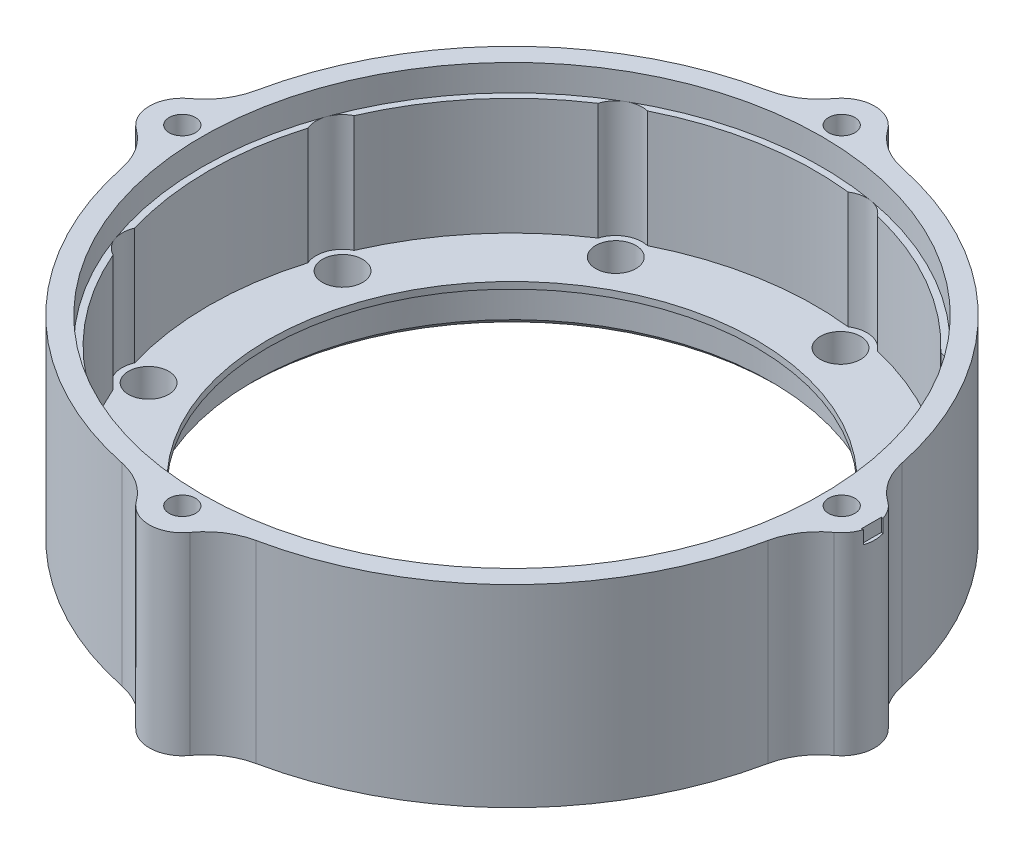
from build123d import *
from build123d.topology import SkipClean

# Parameters (mm, degrees)
SKETCH1_R            = 50
BOSS_EXTRUDE1_DEPTH  = 5
SKETCH2_R            = 3
BOSS_EXTRUDE2_DEPTH  = 30
SKETCH3_R            = 50
BOSS_EXTRUDE3_DEPTH  = 28
SKETCH4_R            = 39.25
CUT_EXTRUDE1_DEPTH   = 6
SKETCH5_R            = 3
CUT_EXTRUDE2_DEPTH   = 44
SKETCH6_R            = 50
SKETCH6_R_2          = 39
BOSS_EXTRUDE4_DEPTH  = 3
CUT_EXTRUDE3_START   = -4
SKETCH7_R            = 47
SKETCH7_R_2          = 46
CUT_EXTRUDE3_DEPTH   = 4
SKETCH8_R            = 39
SKETCH8_R_2          = 37
BOSS_EXTRUDE5_DEPTH  = 1
SKETCH9_R            = 5
SKETCH9_R_2          = 2
BOSS_EXTRUDE6_DEPTH  = 33
SKETCH10_R           = 3.05
CUT_EXTRUDE6_DEPTH   = 2.5
SKETCH11_R           = 47.15
CUT_EXTRUDE7_DEPTH   = 4
SKETCH12_R           = 39.25
SKETCH12_R_2         = 3.05
BOSS_EXTRUDE7_DEPTH  = 6.3
BOSS_EXTRUDE8_START  = -1
SKETCH13_R           = 39.25
SKETCH13_R_2         = 37
BOSS_EXTRUDE8_DEPTH  = 1
SKETCH14_W           = 114
SKETCH14_H           = 3
CUT_EXTRUDE8_DEPTH   = 59.5
SKETCH15_R           = 39.25
SKETCH15_R_2         = 2
BOSS_EXTRUDE9_DEPTH  = 1
SKETCH16_R           = 3.05
BOSS_EXTRUDE10_DEPTH = 0.7
SKETCH17_W           = 114.080184059
SKETCH17_H           = 0.7
CUT_EXTRUDE9_DEPTH   = 69.85
CUT_EXTRUDE10_START  = -8
CUT_EXTRUDE10_DEPTH  = 8
CUT_EXTRUDE12_START  = -21.3
SKETCH20_R           = 57
SKETCH20_R_2         = 50
CUT_EXTRUDE12_DEPTH  = 21.3
BOSS_EXTRUDE11_START = -21.3
BOSS_EXTRUDE11_DEPTH = 21.3
CUT_EXTRUDE13_START  = -21.3
CUT_EXTRUDE13_DEPTH  = 21.3
FILLET1_R            = 10
SKETCH23_R           = 2
BOSS_EXTRUDE12_DEPTH = 8
CUT_EXTRUDE14_START  = -4
SKETCH24_R           = 47
SKETCH24_R_2         = 46
CUT_EXTRUDE14_DEPTH  = 4
SKETCH25_W           = 1
SKETCH25_H           = 3
CUT_EXTRUDE15_DEPTH  = 2
CHAMFER1_SIZE        = 1


# Read off the part's stored shape, not the designer's step: Cut-Extrude13
with BuildPart() as part:
    # Sketch1 → Boss-Extrude1 (new body)
    with BuildSketch(Plane(origin=(0, 0, 0), x_dir=(1, 0, 0), z_dir=(0, 1, 0))):
        with Locations(Location((0, 0, 0), (0, 0, 270))):
            Circle(SKETCH1_R)
    extrude(amount=BOSS_EXTRUDE1_DEPTH)

    # Sketch2 → Boss-Extrude2 (add)
    with BuildSketch(Plane(origin=(0, 5, 0), x_dir=(1, 0, 0), z_dir=(0, 1, 0))):
        with Locations(Location((43, 0, 0), (0, 0, 270))):
            Circle(SKETCH2_R)
        with Locations(Location((32.939911054, -27.639867217, 0), (0, 0, 270))):
            Circle(SKETCH2_R)
        with Locations(Location((7.46687164, -42.34673338, 0), (0, 0, 270))):
            Circle(SKETCH2_R)
        with Locations(Location((-21.5, -37.239092363, 0), (0, 0, 270))):
            Circle(SKETCH2_R)
        with Locations(Location((-40.406782694, -14.706866163, 0), (0, 0, 270))):
            Circle(SKETCH2_R)
        with Locations(Location((-40.406782694, 14.706866163, 0), (0, 0, 270))):
            Circle(SKETCH2_R)
        with Locations(Location((-21.5, 37.239092363, 0), (0, 0, 270))):
            Circle(SKETCH2_R)
        with Locations(Location((7.46687164, 42.34673338, 0), (0, 0, 270))):
            Circle(SKETCH2_R)
        with Locations(Location((32.939911054, 27.639867217, 0), (0, 0, 270))):
            Circle(SKETCH2_R)
    extrude(amount=BOSS_EXTRUDE2_DEPTH)

    # Sketch3 → Boss-Extrude3 (add)
    with BuildSketch(Plane(origin=(0, 5, 0), x_dir=(1, 0, 0), z_dir=(0, 1, 0))):
        with Locations(Location((0, 0, 0), (0, 0, 270))):
            Circle(SKETCH3_R)
        with BuildLine():
            ThreePointArc((45.918604651, 2.735278211), (43.225860556, 15.732926593), (36.933894872, 27.42056545))
            ThreePointArc((36.933894872, 27.42056545), (36.004088827, 30.211017655), (33.417488986, 31.611254798))
            ThreePointArc((33.417488986, 31.611254798), (23, 39.837168574), (10.667405207, 44.746021791))
            ThreePointArc((10.667405207, 44.746021791), (8.16146435, 46.285964392), (5.27995883, 45.695973945))
            ThreePointArc((5.27995883, 45.695973945), (-7.987816173, 45.301156639), (-20.590481909, 41.13431724))
            ThreePointArc((-20.590481909, 41.13431724), (-23.5, 40.703193978), (-25.328122743, 38.399039029))
            ThreePointArc((-25.328122743, 38.399039029), (-35.238044383, 29.568230046), (-42.213853702, 18.275408495))
            ThreePointArc((-42.213853702, 18.275408495), (-44.165553177, 16.074946736), (-44.084894193, 13.134766994))
            ThreePointArc((-44.084894193, 13.134766994), (-46, 0), (-44.084894193, -13.134766994))
            ThreePointArc((-44.084894193, -13.134766994), (-44.165553177, -16.074946736), (-42.213853702, -18.275408495))
            ThreePointArc((-42.213853702, -18.275408495), (-35.238044383, -29.568230046), (-25.328122743, -38.399039029))
            ThreePointArc((-25.328122743, -38.399039029), (-23.5, -40.703193978), (-20.590481909, -41.13431724))
            ThreePointArc((-20.590481909, -41.13431724), (-7.987816173, -45.301156639), (5.27995883, -45.695973945))
            ThreePointArc((5.27995883, -45.695973945), (8.16146435, -46.285964392), (10.667405207, -44.746021791))
            ThreePointArc((10.667405207, -44.746021791), (23, -39.837168574), (33.417488986, -31.611254798))
            ThreePointArc((33.417488986, -31.611254798), (36.004088827, -30.211017655), (36.933894872, -27.42056545))
            ThreePointArc((36.933894872, -27.42056545), (43.225860556, -15.732926593), (45.918604651, -2.735278211))
            ThreePointArc((45.918604651, -2.735278211), (47, 0), (45.918604651, 2.735278211))
        make_face(mode=Mode.SUBTRACT)
    extrude(amount=BOSS_EXTRUDE3_DEPTH)

    # Sketch4 → Cut-Extrude1 (cut)
    with BuildSketch(Plane(origin=(0, 5, 0), x_dir=(1, 0, 0), z_dir=(0, 1, 0))):
        with Locations(Location((0, 0, 0), (0, 0, 270))):
            Circle(SKETCH4_R)
    extrude(amount=-CUT_EXTRUDE1_DEPTH, mode=Mode.SUBTRACT)

    # Sketch5 → Cut-Extrude2 (cut, symmetric)
    with BuildSketch(Plane(origin=(0, 5, 0), x_dir=(1, 0, 0), z_dir=(0, 1, 0))):
        with Locations(Location((43, 0, 0), (0, 0, 270))):
            Circle(SKETCH5_R)
        with Locations(Location((32.939911054, -27.639867217, 0), (0, 0, 270))):
            Circle(SKETCH5_R)
        with Locations(Location((7.46687164, -42.34673338, 0), (0, 0, 270))):
            Circle(SKETCH5_R)
        with Locations(Location((-21.5, -37.239092363, 0), (0, 0, 270))):
            Circle(SKETCH5_R)
        with Locations(Location((-40.406782694, -14.706866163, 0), (0, 0, 270))):
            Circle(SKETCH5_R)
        with Locations(Location((-40.406782694, 14.706866163, 0), (0, 0, 270))):
            Circle(SKETCH5_R)
        with Locations(Location((-21.5, 37.239092363, 0), (0, 0, 270))):
            Circle(SKETCH5_R)
        with Locations(Location((7.46687164, 42.34673338, 0), (0, 0, 270))):
            Circle(SKETCH5_R)
        with Locations(Location((32.939911054, 27.639867217, 0), (0, 0, 270))):
            Circle(SKETCH5_R)
    extrude(amount=CUT_EXTRUDE2_DEPTH, both=True, mode=Mode.SUBTRACT)

    # Sketch6 → Boss-Extrude4 (add)
    with BuildSketch(Plane.XZ):
        with Locations(Location((0, 0, 0), (0, 0, 90))):
            Circle(SKETCH6_R)
        with Locations(Location((0, 0, 0), (0, 0, 270))):
            Circle(SKETCH6_R_2, mode=Mode.SUBTRACT)
    extrude(amount=-BOSS_EXTRUDE4_DEPTH)

    # Sketch7 → Cut-Extrude3 (cut)
    with BuildSketch(Plane(origin=(0, 33, 0), x_dir=(1, 0, 0), z_dir=(0, 1, 0)).offset(CUT_EXTRUDE3_START)):
        with Locations(Location((0, 0, 0), (0, 0, 270))):
            Circle(SKETCH7_R)
        Circle(SKETCH7_R_2, mode=Mode.SUBTRACT)
    extrude(amount=CUT_EXTRUDE3_DEPTH, mode=Mode.SUBTRACT)

    # Sketch8 → Boss-Extrude5 (add)
    with BuildSketch(Plane.XZ):
        with Locations(Location((0, 0, 0), (0, 0, 270))):
            Circle(SKETCH8_R)
        with Locations(Location((0, 0, 0), (0, 0, 270))):
            Circle(SKETCH8_R_2, mode=Mode.SUBTRACT)
    extrude(amount=-BOSS_EXTRUDE5_DEPTH)

    # Sketch9 → Boss-Extrude6 (add)
    # profile 1 of 4: a face of its own
    with BuildSketch(Plane(origin=(0, 33, 0), x_dir=(1, 0, 0), z_dir=(0, 1, 0))):
        with Locations((52, 0)):
            Circle(SKETCH9_R)
        with Locations(Location((52, 0, 0), (0, 0, 270))):
            Circle(SKETCH9_R_2, mode=Mode.SUBTRACT)
    # profile 2 of 4: a face of its own
    with BuildSketch(Plane(origin=(0, 33, 0), x_dir=(1, 0, 0), z_dir=(0, 1, 0))):
        with Locations((-52, 0)):
            Circle(SKETCH9_R)
        with Locations(Location((-52, 0, 0), (0, 0, 270))):
            Circle(SKETCH9_R_2, mode=Mode.SUBTRACT)
    # profile 3 of 4: a face of its own
    with BuildSketch(Plane(origin=(0, 33, 0), x_dir=(1, 0, 0), z_dir=(0, 1, 0))):
        with Locations((0, 52)):
            Circle(SKETCH9_R)
        with Locations(Location((0, 52, 0), (0, 0, 270))):
            Circle(SKETCH9_R_2, mode=Mode.SUBTRACT)
    # profile 4 of 4: a face of its own
    with BuildSketch(Plane(origin=(0, 33, 0), x_dir=(1, 0, 0), z_dir=(0, 1, 0))):
        with Locations((0, -52)):
            Circle(SKETCH9_R)
        with Locations(Location((0, -52, 0), (0, 0, 270))):
            Circle(SKETCH9_R_2, mode=Mode.SUBTRACT)
    extrude(amount=-BOSS_EXTRUDE6_DEPTH)

    # Sketch10 → Cut-Extrude6 (cut)
    with BuildSketch(Plane(origin=(0, 5, 0), x_dir=(1, 0, 0), z_dir=(0, 1, 0))):
        with Locations(Location((32.939911054, -27.639867217, 0), (0, 0, 270))):
            Circle(SKETCH10_R)
        with Locations(Location((43, 0, 0), (0, 0, 270))):
            Circle(SKETCH10_R)
        with Locations(Location((7.46687164, -42.34673338, 0), (0, 0, 270))):
            Circle(SKETCH10_R)
        with Locations(Location((-21.5, -37.239092363, 0), (0, 0, 270))):
            Circle(SKETCH10_R)
        with Locations(Location((-40.406782694, -14.706866163, 0), (0, 0, 270))):
            Circle(SKETCH10_R)
        with Locations(Location((-40.406782694, 14.706866163, 0), (0, 0, 270))):
            Circle(SKETCH10_R)
        with Locations(Location((-21.5, 37.239092363, 0), (0, 0, 270))):
            Circle(SKETCH10_R)
        with Locations(Location((7.46687164, 42.34673338, 0), (0, 0, 270))):
            Circle(SKETCH10_R)
        with Locations(Location((32.939911054, 27.639867217, 0), (0, 0, 270))):
            Circle(SKETCH10_R)
    extrude(amount=-CUT_EXTRUDE6_DEPTH, mode=Mode.SUBTRACT)

    # Sketch11 → Cut-Extrude7 (cut)
    with BuildSketch(Plane(origin=(0, 33, 0), x_dir=(1, 0, 0), z_dir=(0, 1, 0))):
        with Locations(Location((0, 0, 0), (0, 0, 270))):
            Circle(SKETCH11_R)
    extrude(amount=-CUT_EXTRUDE7_DEPTH, mode=Mode.SUBTRACT)

    # Sketch12 → Boss-Extrude7 (add)
    with BuildSketch(Plane(origin=(0, 5, 0), x_dir=(1, 0, 0), z_dir=(0, 1, 0))):
        with BuildLine():
            ThreePointArc((36.933894872, -27.42056545), (43.225860556, -15.732926593), (45.918604651, -2.735278211))
            ThreePointArc((45.918604651, -2.735278211), (47, 0), (45.918604651, 2.735278211))
            ThreePointArc((45.918604651, 2.735278211), (43.225860556, 15.732926593), (36.933894872, 27.42056545))
            ThreePointArc((36.933894872, 27.42056545), (36.004088827, 30.211017655), (33.417488986, 31.611254798))
            ThreePointArc((33.417488986, 31.611254798), (23, 39.837168574), (10.667405207, 44.746021791))
            ThreePointArc((10.667405207, 44.746021791), (8.16146435, 46.285964392), (5.27995883, 45.695973945))
            ThreePointArc((5.27995883, 45.695973945), (-7.987816173, 45.301156639), (-20.590481909, 41.13431724))
            ThreePointArc((-20.590481909, 41.13431724), (-23.5, 40.703193978), (-25.328122743, 38.399039029))
            ThreePointArc((-25.328122743, 38.399039029), (-35.238044383, 29.568230046), (-42.213853702, 18.275408495))
            ThreePointArc((-42.213853702, 18.275408495), (-44.165553177, 16.074946736), (-44.084894193, 13.134766994))
            ThreePointArc((-44.084894193, 13.134766994), (-46, 0), (-44.084894193, -13.134766994))
            ThreePointArc((-44.084894193, -13.134766994), (-44.165553177, -16.074946736), (-42.213853702, -18.275408495))
            ThreePointArc((-42.213853702, -18.275408495), (-35.238044383, -29.568230046), (-25.328122743, -38.399039029))
            ThreePointArc((-25.328122743, -38.399039029), (-23.5, -40.703193978), (-20.590481909, -41.13431724))
            ThreePointArc((-20.590481909, -41.13431724), (-7.987816173, -45.301156639), (5.27995883, -45.695973945))
            ThreePointArc((5.27995883, -45.695973945), (8.16146435, -46.285964392), (10.667405207, -44.746021791))
            ThreePointArc((10.667405207, -44.746021791), (23, -39.837168574), (33.417488986, -31.611254798))
            ThreePointArc((33.417488986, -31.611254798), (36.004088827, -30.211017655), (36.933894872, -27.42056545))
        make_face()
        with Locations(Location((0, 0, 0), (0, 0, 270))):
            Circle(SKETCH12_R, mode=Mode.SUBTRACT)
        with Locations(Location((32.939911054, -27.639867217, 0), (0, 0, 270))):
            Circle(SKETCH12_R_2, mode=Mode.SUBTRACT)
        with Locations(Location((43, 0, 0), (0, 0, 270))):
            Circle(SKETCH12_R_2, mode=Mode.SUBTRACT)
        with Locations(Location((7.46687164, -42.34673338, 0), (0, 0, 270))):
            Circle(SKETCH12_R_2, mode=Mode.SUBTRACT)
        with Locations(Location((-21.5, -37.239092363, 0), (0, 0, 270))):
            Circle(SKETCH12_R_2, mode=Mode.SUBTRACT)
        with Locations(Location((-40.406782694, -14.706866163, 0), (0, 0, 270))):
            Circle(SKETCH12_R_2, mode=Mode.SUBTRACT)
        with Locations(Location((-40.406782694, 14.706866163, 0), (0, 0, 270))):
            Circle(SKETCH12_R_2, mode=Mode.SUBTRACT)
        with Locations(Location((-21.5, 37.239092363, 0), (0, 0, 270))):
            Circle(SKETCH12_R_2, mode=Mode.SUBTRACT)
        with Locations(Location((7.46687164, 42.34673338, 0), (0, 0, 270))):
            Circle(SKETCH12_R_2, mode=Mode.SUBTRACT)
        with Locations(Location((32.939911054, 27.639867217, 0), (0, 0, 270))):
            Circle(SKETCH12_R_2, mode=Mode.SUBTRACT)
    extrude(amount=BOSS_EXTRUDE7_DEPTH)

    # Sketch13 → Boss-Extrude8 (add)
    with BuildSketch(Plane(origin=(0, 11.3, 0), x_dir=(1, 0, 0), z_dir=(0, 1, 0)).offset(BOSS_EXTRUDE8_START)):
        with Locations(Location((0, 0, 0), (0, 0, 270))):
            Circle(SKETCH13_R)
        with Locations(Location((0, 0, 0), (0, 0, 90))):
            Circle(SKETCH13_R_2, mode=Mode.SUBTRACT)
    extrude(amount=BOSS_EXTRUDE8_DEPTH)

    # Sketch14 → Cut-Extrude8 (cut, symmetric)
    with BuildSketch(Plane.XY):
        with Locations((0, 1.5)):
            Rectangle(SKETCH14_W, SKETCH14_H)
    extrude(amount=CUT_EXTRUDE8_DEPTH, both=True, mode=Mode.SUBTRACT)

    # Sketch15 → Boss-Extrude9 (add)
    with BuildSketch(Plane.XZ.offset(-3)):
        with BuildLine():
            ThreePointArc((4.489046086, -49.798076923), (35.355339059, -35.355339059), (49.798076923, -4.489046086))
            ThreePointArc((49.798076923, -4.489046086), (57, 0), (49.798076923, 4.489046086))
            ThreePointArc((49.798076923, 4.489046086), (35.355339059, 35.355339059), (4.489046086, 49.798076923))
            ThreePointArc((4.489046086, 49.798076923), (0, 57), (-4.489046086, 49.798076923))
            ThreePointArc((-4.489046086, 49.798076923), (-35.355339059, 35.355339059), (-49.798076923, 4.489046086))
            ThreePointArc((-49.798076923, 4.489046086), (-57, 0), (-49.798076923, -4.489046086))
            ThreePointArc((-49.798076923, -4.489046086), (-35.355339059, -35.355339059), (-4.489046086, -49.798076923))
            ThreePointArc((-4.489046086, -49.798076923), (0, -57), (4.489046086, -49.798076923))
        make_face()
        with Locations(Location((0, 0, 0), (0, 0, 90))):
            Circle(SKETCH15_R, mode=Mode.SUBTRACT)
        with Locations(Location((0, -52, 0), (0, 0, 90))):
            Circle(SKETCH15_R_2, mode=Mode.SUBTRACT)
        with Locations(Location((52, 0, 0), (0, 0, 90))):
            Circle(SKETCH15_R_2, mode=Mode.SUBTRACT)
        with Locations(Location((-52, 0, 0), (0, 0, 180))):
            Circle(SKETCH15_R_2, mode=Mode.SUBTRACT)
        with Locations(Location((0, 52, 0), (0, 0, 180))):
            Circle(SKETCH15_R_2, mode=Mode.SUBTRACT)
    extrude(amount=-BOSS_EXTRUDE9_DEPTH)

    # Sketch16 → Boss-Extrude10 (add)
    with BuildSketch(Plane(origin=(0, 4, 0), x_dir=(1, 0, 0), z_dir=(0, 1, 0))):
        with Locations(Location((32.939911054, -27.639867217, 0), (0, 0, 270))):
            Circle(SKETCH16_R)
        with Locations(Location((43, 0, 0), (0, 0, 270))):
            Circle(SKETCH16_R)
        with Locations(Location((7.46687164, -42.34673338, 0), (0, 0, 270))):
            Circle(SKETCH16_R)
        with Locations(Location((-21.5, -37.239092363, 0), (0, 0, 270))):
            Circle(SKETCH16_R)
        with Locations(Location((-40.406782694, -14.706866163, 0), (0, 0, 270))):
            Circle(SKETCH16_R)
        with Locations(Location((-40.406782694, 14.706866163, 0), (0, 0, 270))):
            Circle(SKETCH16_R)
        with Locations(Location((-21.5, 37.239092363, 0), (0, 0, 270))):
            Circle(SKETCH16_R)
        with Locations(Location((7.46687164, 42.34673338, 0), (0, 0, 270))):
            Circle(SKETCH16_R)
        with Locations(Location((32.939911054, 27.639867217, 0), (0, 0, 270))):
            Circle(SKETCH16_R)
    extrude(amount=BOSS_EXTRUDE10_DEPTH)

    # Sketch17 → Cut-Extrude9 (cut, symmetric)
    with BuildSketch(Plane.XY):
        with Locations((-0.04009203, 3.35)):
            Rectangle(SKETCH17_W, SKETCH17_H)
    extrude(amount=CUT_EXTRUDE9_DEPTH, both=True, mode=Mode.SUBTRACT)

    # Sketch18 → Cut-Extrude10 (cut)
    with BuildSketch(Plane(origin=(0, 33, 0), x_dir=(1, 0, 0), z_dir=(0, 1, 0)).offset(CUT_EXTRUDE10_START)):
        with BuildLine():
            ThreePointArc((4.489046086, -49.798076923), (35.355339059, -35.355339059), (49.798076923, -4.489046086))
            ThreePointArc((49.798076923, -4.489046086), (57, 0), (49.798076923, 4.489046086))
            ThreePointArc((49.798076923, 4.489046086), (35.355339059, 35.355339059), (4.489046086, 49.798076923))
            ThreePointArc((4.489046086, 49.798076923), (0, 57), (-4.489046086, 49.798076923))
            ThreePointArc((-4.489046086, 49.798076923), (-35.355339059, 35.355339059), (-49.798076923, 4.489046086))
            ThreePointArc((-49.798076923, 4.489046086), (-57, 0), (-49.798076923, -4.489046086))
            ThreePointArc((-49.798076923, -4.489046086), (-35.355339059, -35.355339059), (-4.489046086, -49.798076923))
            ThreePointArc((-4.489046086, -49.798076923), (0, -57), (4.489046086, -49.798076923))
        make_face()
    extrude(amount=CUT_EXTRUDE10_DEPTH, mode=Mode.SUBTRACT)

    # Sketch20 → Cut-Extrude12 (cut)
    with BuildSketch(Plane(origin=(0, 25, 0), x_dir=(1, 0, 0), z_dir=(0, 1, 0)).offset(CUT_EXTRUDE12_START)):
        Circle(SKETCH20_R)
        with Locations(Location((0, 0, 0), (0, 0, 180))):
            Circle(SKETCH20_R_2, mode=Mode.SUBTRACT)
    extrude(amount=CUT_EXTRUDE12_DEPTH, mode=Mode.SUBTRACT)

    # Sketch21 → Boss-Extrude11 (add)
    with BuildSketch(Plane(origin=(0, 25, 0), x_dir=(1, 0, 0), z_dir=(0, 1, 0)).offset(BOSS_EXTRUDE11_START)):
        with BuildLine():
            ThreePointArc((49.96, 1.99959996), (51.4, 1.428285686), (52, 0))
            ThreePointArc((52, 0), (51.4, -1.428285686), (49.96, -1.99959996))
            ThreePointArc((49.96, -1.99959996), (49.877472397, -3.498249168), (49.75, -4.993746089))
            ThreePointArc((49.75, -4.993746089), (55, 0), (49.75, 4.993746089))
            ThreePointArc((49.75, 4.993746089), (49.877472397, 3.498249168), (49.96, 1.99959996))
        make_face()
        with BuildLine():
            ThreePointArc((-4.992800781, -49.750094878), (0.001100002, -54.998999999), (4.994790821, -49.749895122))
            ThreePointArc((4.994790821, -49.749895122), (3.499281509, -49.877399982), (2.000618918, -49.959959207))
            ThreePointArc((2.000618918, -49.959959207), (2.000904727, -49.979478673), (2.001, -49.999))
            ThreePointArc((2.001, -49.999), (-0.018481328, -51.998905117), (-1.998620478, -49.960039193))
            ThreePointArc((-1.998620478, -49.960039193), (-3.497286371, -49.877539916), (-4.992800781, -49.750094878))
        make_face()
        with BuildLine():
            ThreePointArc((-49.95999844, 1.999638938), (-49.877467544, 3.498318366), (-49.74999004, 4.993845318))
            ThreePointArc((-49.74999004, 4.993845318), (-54.998, 0), (-49.74999004, -4.993845318))
            ThreePointArc((-49.74999004, -4.993845318), (-49.877467544, -3.498318366), (-49.95999844, -1.999638938))
            ThreePointArc((-49.95999844, -1.999638938), (-51.998, 0), (-49.95999844, 1.999638938))
        make_face()
        with BuildLine():
            ThreePointArc((2.000618918, 49.959959207), (3.499281509, 49.877399982), (4.994790821, 49.749895122))
            ThreePointArc((4.994790821, 49.749895122), (0.001100002, 54.998999999), (-4.992800781, 49.750094878))
            ThreePointArc((-4.992800781, 49.750094878), (-3.497286371, 49.877539916), (-1.998620478, 49.960039193))
            ThreePointArc((-1.998620478, 49.960039193), (-0.018481328, 51.998905117), (2.001, 49.999))
            ThreePointArc((2.001, 49.999), (2.000904727, 49.979478673), (2.000618918, 49.959959207))
        make_face()
    extrude(amount=BOSS_EXTRUDE11_DEPTH)

    # Cut-Extrude13 outline → Cut-Extrude13 (cut)
    with SkipClean():  # the faces are left unmerged after this step: merging them gives an invalid solid
        with BuildSketch(Plane(origin=(0, 25, 0), x_dir=(1, 0, 0), z_dir=(0, 1, 0)).offset(CUT_EXTRUDE13_START)):
            with BuildLine():
                ThreePointArc((49.96, -1.99959996), (50, 0), (49.96, 1.99959996))
                ThreePointArc((49.96, 1.99959996), (48, 0), (49.96, -1.99959996))
            make_face()
            with BuildLine():
                ThreePointArc((-1.998620478, -49.960039193), (0.00100002, -49.99999999), (2.000618918, -49.959959207))
                ThreePointArc((2.000618918, -49.959959207), (0.000959999, -47.999), (-1.998620478, -49.960039193))
            make_face()
            with BuildLine():
                ThreePointArc((-49.95999844, -1.999638938), (-47.998, 0), (-49.95999844, 1.999638938))
                ThreePointArc((-49.95999844, 1.999638938), (-50, 0), (-49.95999844, -1.999638938))
            make_face()
            with BuildLine():
                ThreePointArc((2.000618918, 49.959959207), (0.00100002, 49.99999999), (-1.998620478, 49.960039193))
                ThreePointArc((-1.998620478, 49.960039193), (0.000959999, 47.999), (2.000618918, 49.959959207))
            make_face()
        extrude(amount=CUT_EXTRUDE13_DEPTH, mode=Mode.SUBTRACT)

    # Fillet1
    fillet1_edges = [part.edges().sort_by_distance(p)[0] for p in [
        (49.75, 14.35, 4.993746089),
        (49.75, 14.35, -4.993746089),
        (-4.992800781, 14.35, 49.750094878),
        (4.994790821, 14.35, 49.749895122),
        (-49.74999004, 14.35, -4.993845318),
        (-49.74999004, 14.35, 4.993845318),
        (4.994790821, 14.35, -49.749895122),
        (-4.992800781, 14.35, -49.750094878),
    ]]
    fillet(fillet1_edges, radius=FILLET1_R)

    # Sketch23 → Boss-Extrude12 (add)
    with SkipClean():  # the faces are left unmerged after this step: merging them gives an invalid solid
        with BuildSketch(Plane(origin=(0, 25, 0), x_dir=(1, 0, 0), z_dir=(0, 1, 0))):
            with BuildLine():
                ThreePointArc((-48.958625045, -10.151504012), (-35.355239503, -35.355438615), (-10.151228289, -48.958682215))
                ThreePointArc((-10.151228289, -48.958682215), (-6.733482579, -50.364752909), (-4.059824649, -52.916139553))
                ThreePointArc((-4.059824649, -52.916139553), (0.001100002, -54.998999999), (4.061941334, -52.915977114))
                ThreePointArc((4.061941334, -52.915977114), (6.735497204, -50.364483524), (10.153186668, -48.958276118))
                ThreePointArc((10.153186668, -48.958276118), (35.355438677, -35.355239441), (48.958333333, -10.152910776))
                ThreePointArc((48.958333333, -10.152910776), (50.364745084, -6.734869252), (52.916666667, -4.06116431))
                ThreePointArc((52.916666667, -4.06116431), (55, 0), (52.916666667, 4.06116431))
                ThreePointArc((52.916666667, 4.06116431), (50.364745084, 6.734869252), (48.958333333, 10.152910776))
                ThreePointArc((48.958333333, 10.152910776), (35.355438677, 35.355239441), (10.153186668, 48.958276118))
                ThreePointArc((10.153186668, 48.958276118), (6.735497204, 50.364483524), (4.061941334, 52.915977114))
                ThreePointArc((4.061941334, 52.915977114), (0.001100002, 54.998999999), (-4.059824649, 52.916139553))
                ThreePointArc((-4.059824649, 52.916139553), (-6.733482579, 50.364752909), (-10.151228289, 48.958682215))
                ThreePointArc((-10.151228289, 48.958682215), (-35.355239503, 35.355438615), (-48.958625045, 10.151504012))
                ThreePointArc((-48.958625045, 10.151504012), (-50.364491386, 6.734110404), (-52.915450018, 4.060601605))
                ThreePointArc((-52.915450018, 4.060601605), (-54.998, 0), (-52.915450018, -4.060601605))
                ThreePointArc((-52.915450018, -4.060601605), (-50.364491386, -6.734110404), (-48.958625045, -10.151504012))
            make_face()
            with Locations(Location((0, -50, 0), (0, 0, 134.979742882))):
                Circle(SKETCH23_R, mode=Mode.SUBTRACT)
            with Locations(Location((50, 0, 0), (0, 0, 270))):
                Circle(SKETCH23_R, mode=Mode.SUBTRACT)
            with Locations(Location((-50, 0, 0), (0, 0, 89.971352109))):
                Circle(SKETCH23_R, mode=Mode.SUBTRACT)
            with Locations(Location((0, 50, 0), (0, 0, 44.979742883))):
                Circle(SKETCH23_R, mode=Mode.SUBTRACT)
            with BuildLine():
                ThreePointArc((-42.213853702, 18.275408495), (-44.165553177, 16.074946736), (-44.084894193, 13.134766994))
                ThreePointArc((-44.084894193, 13.134766994), (-46, 0), (-44.084894193, -13.134766994))
                ThreePointArc((-44.084894193, -13.134766994), (-44.165553177, -16.074946736), (-42.213853702, -18.275408495))
                ThreePointArc((-42.213853702, -18.275408495), (-35.238044383, -29.568230046), (-25.328122743, -38.399039029))
                ThreePointArc((-25.328122743, -38.399039029), (-23.5, -40.703193978), (-20.590481909, -41.13431724))
                ThreePointArc((-20.590481909, -41.13431724), (-7.987816173, -45.301156639), (5.27995883, -45.695973945))
                ThreePointArc((5.27995883, -45.695973945), (8.16146435, -46.285964392), (10.667405207, -44.746021791))
                ThreePointArc((10.667405207, -44.746021791), (23, -39.837168574), (33.417488986, -31.611254798))
                ThreePointArc((33.417488986, -31.611254798), (36.004088827, -30.211017655), (36.933894872, -27.42056545))
                ThreePointArc((36.933894872, -27.42056545), (43.225860556, -15.732926593), (45.918604651, -2.735278211))
                ThreePointArc((45.918604651, -2.735278211), (47, 0), (45.918604651, 2.735278211))
                ThreePointArc((45.918604651, 2.735278211), (43.225860556, 15.732926593), (36.933894872, 27.42056545))
                ThreePointArc((36.933894872, 27.42056545), (36.004088827, 30.211017655), (33.417488986, 31.611254798))
                ThreePointArc((33.417488986, 31.611254798), (23, 39.837168574), (10.667405207, 44.746021791))
                ThreePointArc((10.667405207, 44.746021791), (8.16146435, 46.285964392), (5.27995883, 45.695973945))
                ThreePointArc((5.27995883, 45.695973945), (-7.987816173, 45.301156639), (-20.590481909, 41.13431724))
                ThreePointArc((-20.590481909, 41.13431724), (-23.5, 40.703193978), (-25.328122743, 38.399039029))
                ThreePointArc((-25.328122743, 38.399039029), (-35.238044383, 29.568230046), (-42.213853702, 18.275408495))
            make_face(mode=Mode.SUBTRACT)
        extrude(amount=BOSS_EXTRUDE12_DEPTH)

    # Sketch24 → Cut-Extrude14 (cut)
    with SkipClean():  # the faces are left unmerged after this step: merging them gives an invalid solid
        with BuildSketch(Plane(origin=(0, 33, 0), x_dir=(1, 0, 0), z_dir=(0, 1, 0)).offset(CUT_EXTRUDE14_START)):
            with Locations(Location((0, 0, 0), (0, 0, 270))):
                Circle(SKETCH24_R)
            Circle(SKETCH24_R_2, mode=Mode.SUBTRACT)
        extrude(amount=CUT_EXTRUDE14_DEPTH, mode=Mode.SUBTRACT)

    # Sketch25 → Cut-Extrude15 (cut)
    with SkipClean():  # the faces are left unmerged after this step: merging them gives an invalid solid
        with BuildSketch(Plane(origin=(0, 33, 0), x_dir=(1, 0, 0), z_dir=(0, 1, 0))):
            with Locations((55, 0)):
                Rectangle(SKETCH25_W, SKETCH25_H)
        extrude(amount=-CUT_EXTRUDE15_DEPTH, mode=Mode.SUBTRACT)

    # Chamfer1
    chamfer1_edges = [part.edges().sort_by_distance(p)[0] for p in [
        (0, 3.7, -39.25),
    ]]
    chamfer(chamfer1_edges, length=CHAMFER1_SIZE)


solid = part.part
